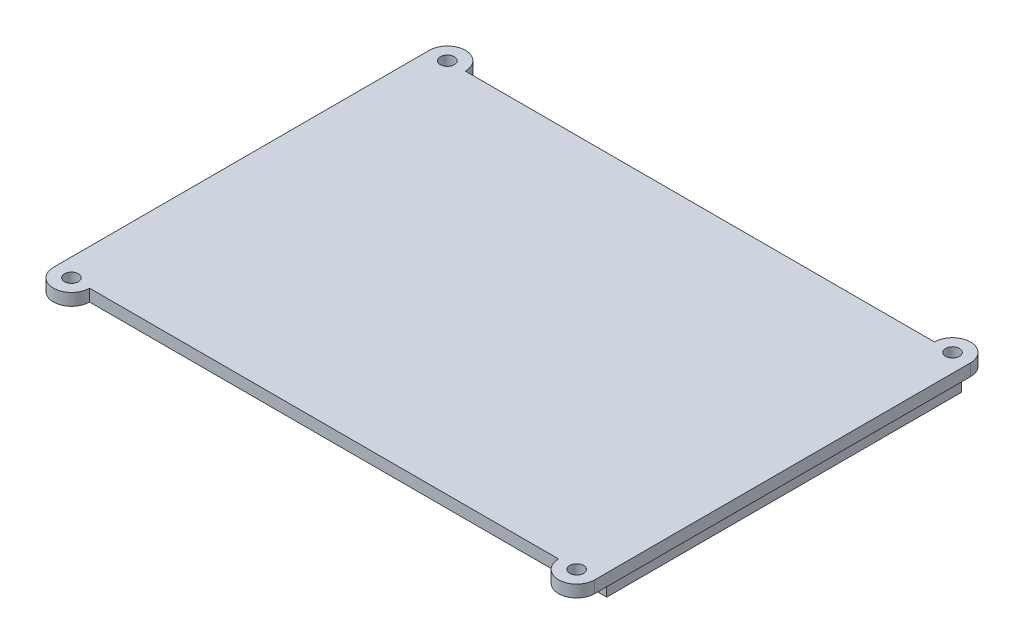
from build123d import *

# Parameters (mm, degrees)
BASE_EXTRUDE_DEPTH   = 2
HOLES_R              = 1.15
HOLES_CUT_DEPTH      = 112.329466001
SKETCH3_W            = 87
SKETCH3_H            = 59
INSIDE_EXTRUDE_DEPTH = 2


with BuildPart() as part:
    # Base → Base Extrude (new body)
    with BuildSketch(Plane(origin=(0, 0, 0), x_dir=(1, 0, 0), z_dir=(0, 1, 0))):
        with BuildLine():
            Line((6, 0), (84, 0))
            ThreePointArc((84, 0), (87, -3), (90, 0))
            Line((90, 0), (90, 62.5))
            ThreePointArc((90, 62.5), (87, 65.5), (84, 62.5))
            Line((84, 62.5), (6, 62.5))
            ThreePointArc((6, 62.5), (3, 65.5), (0, 62.5))
            Line((0, 62.5), (0, 0))
            ThreePointArc((0, 0), (3, -3), (6, 0))
        make_face()
    extrude(amount=BASE_EXTRUDE_DEPTH)

    # Holes → Holes Cut (cut, through all)
    with BuildSketch(Plane(origin=(0, 2, 0), x_dir=(1, 0, 0), z_dir=(0, 1, 0))):
        with Locations((3, 62.5)):
            Circle(HOLES_R)
        with Locations((87, 62.5)):
            Circle(HOLES_R)
        with Locations((87, 0)):
            Circle(HOLES_R)
        with Locations((3, 0)):
            Circle(HOLES_R)
    extrude(amount=-HOLES_CUT_DEPTH, mode=Mode.SUBTRACT)

    # Sketch3 → Inside Extrude (add)
    with BuildSketch(Plane.XZ):
        with Locations((46, -32)):
            Rectangle(SKETCH3_W, SKETCH3_H)
    extrude(amount=INSIDE_EXTRUDE_DEPTH)


solid = part.part
